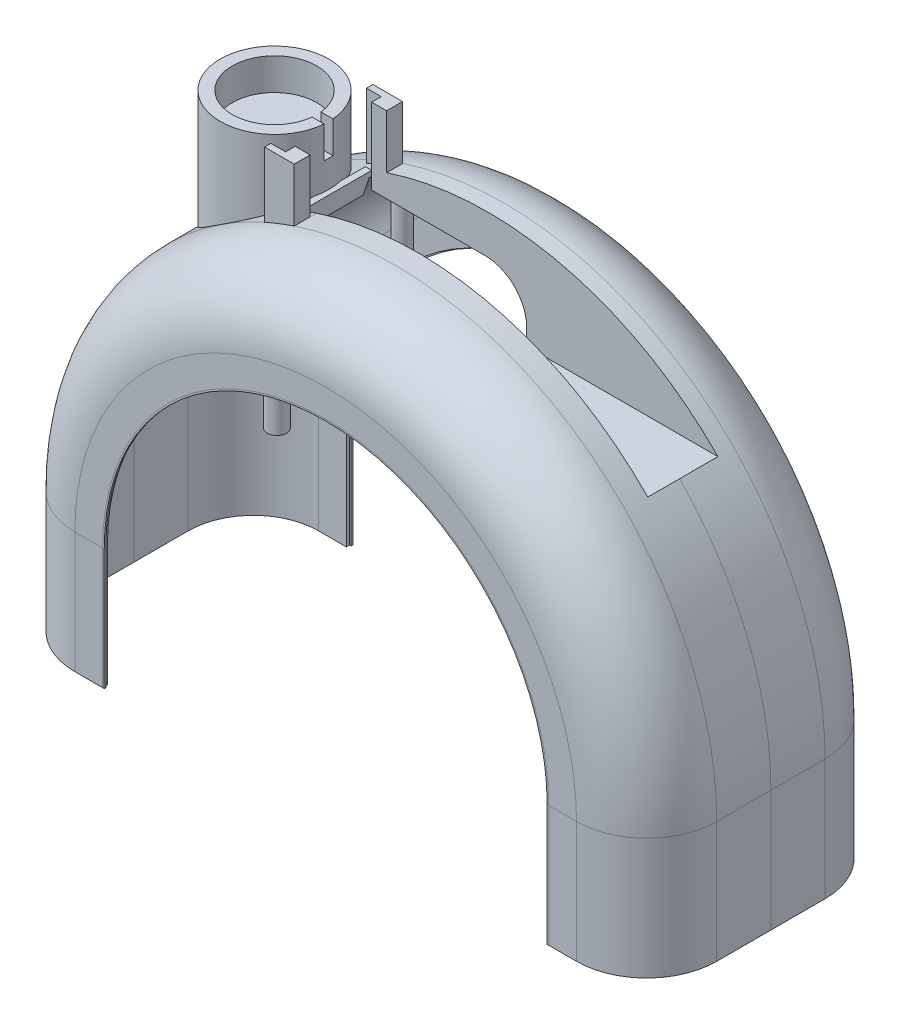
from build123d import *

# Parameters (mm, degrees)
BOSS_EXTRUDE7_REACH       = 234.87
SKETCH4_R                 = 3
SKETCH7_R                 = 3
CUT_EXTRUDE2_DEPTH        = 35.9
SKETCH10_W                = 108.621815142
SKETCH10_H                = 24
CUT_EXTRUDE4_DEPTH        = 217.167286261
SKETCH11_R                = 17
BOSS_EXTRUDE8_DEPTH       = 42
CUT_EXTRUDE5_REACH        = 218.167
CUT_EXTRUDE5_END_RADIUS   = 99.2
BOSS_EXTRUDE11_REACH      = 241.985
BOSS_EXTRUDE11_END_RADIUS = 100.7
CUT_EXTRUDE6_START        = -10
CUT_EXTRUDE6_DEPTH        = 10
SKETCH15_W                = 60
SKETCH15_H                = 24
BOSS_EXTRUDE12_DEPTH      = 2
BOSS_EXTRUDE13_DEPTH      = 2
BOSS_EXTRUDE26_DEPTH      = 2
BOSS_EXTRUDE28_DEPTH      = 2
BOSS_EXTRUDE29_REACH      = 241.985
SKETCH22_R                = 2.5
SKETCH24_R                = 2.5
CUT_EXTRUDE8_DEPTH        = 98.5
SKETCH25_R                = 2.5
CUT_EXTRUDE9_DEPTH        = 108
SKETCH46_R                = 1.25
CUT_EXTRUDE10_DEPTH       = 10
SKETCH47_R                = 1.25
CUT_EXTRUDE11_DEPTH       = 10
SKETCH48_R                = 1.25
CUT_EXTRUDE12_DEPTH       = 10
BOSS_EXTRUDE30_START      = 5.8
SKETCH49_R                = 3
SKETCH49_R_2              = 1.25
BOSS_EXTRUDE30_DEPTH      = 5.8


with BuildPart() as part:
    # Sweep1: sweep along a path in Sketch3
    with BuildLine(Plane.XY) as sweep1_path:
        Line((0, 0), (0, 38))
        ThreePointArc((0, 38), (70, 108), (140, 38))
        Line((140, 38), (140, 0))
    # Sketch1 → Sweep1 (sweep)
    with BuildSketch(Plane(origin=(0, 0, 0), x_dir=(1, 0, 0), z_dir=(0, 1, 0))):
        with BuildLine():
            Line((0, 0), (0, -1))
            Line((0, -1), (0.5, -1))
            Line((0.5, -1), (0.5, -1.5))
            Line((0.5, -1.5), (0, -1.5))
            Line((0, -1.5), (-8.7, -1.5))
            ThreePointArc((-8.7, -1.5), (-24.256349186, 4.943650814), (-30.7, 20.5))
            Line((-30.7, 20.5), (-30.7, 37.5))
            Line((-30.7, 37.5), (-30.7, 54.5))
            ThreePointArc((-30.7, 54.5), (-24.256349186, 70.056349186), (-8.7, 76.5))
            Line((-8.7, 76.5), (0, 76.5))
            Line((0, 76.5), (0.5, 76.5))
            Line((0.5, 76.5), (0.5, 76))
            Line((0.5, 76), (0, 76))
            Line((0, 76), (0, 75))
            Line((0, 75), (-8.7, 75))
            ThreePointArc((-8.7, 75), (-23.195689014, 68.995689014), (-29.2, 54.5))
            Line((-29.2, 54.5), (-29.2, 37.5))
            Line((-29.2, 37.5), (-29.2, 20.5))
            ThreePointArc((-29.2, 20.5), (-23.195689014, 6.004310986), (-8.7, 0))
            Line((-8.7, 0), (0, 0))
        make_face()
    sweep(path=sweep1_path.line)

    # Sketch4 → Boss-Extrude7 (add, up to next)
    with BuildSketch(Plane(origin=(0, 0, 0), x_dir=(1, 0, 0), z_dir=(0, 1, 0)), mode=Mode.PRIVATE) as boss_extrude7_sk1:
        with Locations((-13.2, 8.6)):
            Circle(SKETCH4_R)
    boss_extrude7_tool1 = extrude(boss_extrude7_sk1.sketch, amount=BOSS_EXTRUDE7_REACH, mode=Mode.PRIVATE) - part.part
    # Sketch4 → Boss-Extrude7 (add, up to next)
    with BuildSketch(Plane(origin=(0, 0, 0), x_dir=(1, 0, 0), z_dir=(0, 1, 0)), mode=Mode.PRIVATE) as boss_extrude7_sk2:
        with Locations((153.2, 8.6)):
            Circle(SKETCH4_R)
    boss_extrude7_tool2 = extrude(boss_extrude7_sk2.sketch, amount=BOSS_EXTRUDE7_REACH, mode=Mode.PRIVATE) - part.part
    boss_extrude7_1 = boss_extrude7_tool1.solids().sort_by_distance((-13.2, 0, -8.6))[0]
    add(boss_extrude7_1)
    boss_extrude7_2 = boss_extrude7_tool2.solids().sort_by_distance((153.2, 0, -8.6))[0]
    add(boss_extrude7_2)
    boss_extrude7 = boss_extrude7_1 + boss_extrude7_2  # Boss-Extrude7 as one shape, for the pattern or mirror that repeats it

    # Mirror1: Boss-Extrude7 across plane
    add(boss_extrude7.mirror(Plane.XY.offset(-37.5)))

    # Sketch7 → Cut-Extrude2 (cut)
    with BuildSketch(Plane(origin=(0, 0, 0), x_dir=(1, 0, 0), z_dir=(0, 1, 0))):
        with Locations((-13.2, 8.6)):
            Circle(SKETCH7_R)
        with Locations((-13.2, 66.4)):
            Circle(SKETCH7_R)
        with Locations((153.2, 8.6)):
            Circle(SKETCH7_R)
        with Locations((153.2, 66.4)):
            Circle(SKETCH7_R)
    extrude(amount=CUT_EXTRUDE2_DEPTH, mode=Mode.SUBTRACT)

    # Sketch10 → Cut-Extrude4 (cut, through all)
    with BuildSketch(Plane(origin=(0, 108.34, 0), x_dir=(-1, 0, 0), z_dir=(0, -1, 0))):
        with Locations((-87.75, 37.5)):
            Rectangle(SKETCH10_W, SKETCH10_H)
    extrude(amount=-CUT_EXTRUDE4_DEPTH, mode=Mode.SUBTRACT)

    # Sketch11 → Boss-Extrude8 (add)
    with BuildSketch(Plane(origin=(0, 108.34, 0), x_dir=(-1, 0, 0), z_dir=(0, -1, 0))):
        with Locations((-14.939092429, 37.5)):
            Circle(SKETCH11_R)
    extrude(amount=-BOSS_EXTRUDE8_DEPTH)

    # Cut-Extrude5: up to this cylinder (the profile starts inside it)
    cut_extrude5_end = Plane(origin=(70, 38, -37.5), z_dir=(0, 0, -1)) * Cylinder(CUT_EXTRUDE5_END_RADIUS, 635.734, mode=Mode.PRIVATE)
    # Sketch12 → Cut-Extrude5 (cut, up to the surface)
    with BuildSketch(Plane.XZ.offset(-108.34), mode=Mode.PRIVATE) as cut_extrude5_sk1:
        with BuildLine():
            Line((0.050558258, -29.294419566), (0.050558258, -45.705580434))
            ThreePointArc((0.050558258, -45.705580434), (31.939092429, -37.5), (0.050558258, -29.294419566))
        make_face()
    cut_extrude5_tool1 = extrude(cut_extrude5_sk1.sketch, amount=-CUT_EXTRUDE5_REACH, mode=Mode.PRIVATE) & cut_extrude5_end
    add(cut_extrude5_tool1.solids().sort_by_distance((15.355512, 108.34, -37.5))[0], mode=Mode.SUBTRACT)

    # Boss-Extrude11: up to this cylinder (the profile starts outside it)
    boss_extrude11_end = Plane(origin=(70, 38, -37.5), z_dir=(0, 0, -1)) * Cylinder(BOSS_EXTRUDE11_END_RADIUS, 716.222396, mode=Mode.PRIVATE)
    # Sketch13 → Boss-Extrude11 (add, up to the surface)
    with BuildSketch(Plane(origin=(0, 150.34, 0), x_dir=(1, 0, 0), z_dir=(0, 1, 0)), mode=Mode.PRIVATE) as boss_extrude11_sk1:
        Polygon((28.810209538, 54.5), (38.10406279, 54.5), (38.10406279, 49.5), (33.439092429, 49.5), (33.439092429, 52.5), (28.810209538, 52.5), align=None)
    boss_extrude11_tool1 = extrude(boss_extrude11_sk1.sketch, amount=-BOSS_EXTRUDE11_REACH, mode=Mode.PRIVATE) - boss_extrude11_end
    add(boss_extrude11_tool1.solids().sort_by_distance((34.451237, 150.34, -52.426198))[0])
    # Sketch13 → Boss-Extrude11 (add, up to the surface)
    with BuildSketch(Plane(origin=(0, 150.34, 0), x_dir=(1, 0, 0), z_dir=(0, 1, 0)), mode=Mode.PRIVATE) as boss_extrude11_sk2:
        Polygon((33.439092429, 22.5), (28.810209538, 22.5), (28.810209538, 20.5), (38.10406279, 20.5), (38.10406279, 25.5), (33.439092429, 25.5), align=None)
    boss_extrude11_tool2 = extrude(boss_extrude11_sk2.sketch, amount=-BOSS_EXTRUDE11_REACH, mode=Mode.PRIVATE) - boss_extrude11_end
    add(boss_extrude11_tool2.solids().sort_by_distance((34.451237, 150.34, -22.573802))[0])

    # Sketch14 → Cut-Extrude6 (cut)
    with BuildSketch(Plane(origin=(0, 150.34, 0), x_dir=(1, 0, 0), z_dir=(0, 1, 0)).offset(CUT_EXTRUDE6_START)):
        with BuildLine():
            Line((28.116507767, 38.885), (31.882580116, 38.885))
            ThreePointArc((31.882580116, 38.885), (31.939092429, 37.5), (31.882580116, 36.115))
            Line((31.882580116, 36.115), (28.116507767, 36.115))
            ThreePointArc((28.116507767, 36.115), (1.689092429, 37.5), (28.116507767, 38.885))
        make_face()
    extrude(amount=CUT_EXTRUDE6_DEPTH, mode=Mode.SUBTRACT)

    # Sketch15 → Boss-Extrude12 (add)
    with BuildSketch(Plane(origin=(0, 108.34, 0), x_dir=(-1, 0, 0), z_dir=(0, -1, 0))):
        with Locations((-112.060907571, 37.5)):
            Rectangle(SKETCH15_W, SKETCH15_H)
    extrude(amount=BOSS_EXTRUDE12_DEPTH)

    # Sketch17 → Boss-Extrude13 (add)
    with BuildSketch(Plane(origin=(33.439092429, 0, 0), x_dir=(0, 0, -1), z_dir=(1, 0, 0))):
        Polygon((25.5, 131.82851399), (25.5, 126.42851399), (46.832257308, 126.42851399), (49.5, 131.82851399), align=None)
    extrude(amount=-BOSS_EXTRUDE13_DEPTH)

    # Sketch18 → Boss-Extrude26 (add)
    with BuildSketch(Plane.XY.offset(-49.5)):
        with BuildLine():
            Line((142.060907571, 108.34), (141.904689694, 106.34))
            Line((141.904689694, 106.34), (82.060907571, 106.34))
            Line((82.060907571, 106.34), (82.060907571, 113.42851399))
            ThreePointArc((82.060907571, 113.42851399), (78.253295727, 122.620902145), (69.060907571, 126.42851399))
            Line((69.060907571, 126.42851399), (33.439092429, 126.42851399))
            Line((33.439092429, 126.42851399), (33.439092429, 130.216809951))
            Line((33.439092429, 130.216809951), (33.439092429, 131.82851399))
            Line((33.439092429, 131.82851399), (38.10406279, 133.515125449))
            ThreePointArc((38.10406279, 133.515125449), (93.701327945, 135.871022543), (142.060907571, 108.34))
        make_face()
    extrude(amount=-BOSS_EXTRUDE26_DEPTH)

    # Sketch20 → Boss-Extrude28 (add)
    with BuildSketch(Plane(origin=(0, 0, -25.5), x_dir=(-1, 0, 0), z_dir=(0, 0, -1))):
        with BuildLine():
            Line((-141.904689694, 106.34), (-82.060907571, 106.34))
            Line((-82.060907571, 106.34), (-82.060907571, 113.42851399))
            ThreePointArc((-82.060907571, 113.42851399), (-78.253295727, 122.620902145), (-69.060907571, 126.42851399))
            Line((-69.060907571, 126.42851399), (-33.439092429, 126.42851399))
            Line((-33.439092429, 126.42851399), (-33.439092429, 130.216809951))
            Line((-33.439092429, 130.216809951), (-33.439092429, 131.82851399))
            Line((-33.439092429, 131.82851399), (-38.10406279, 133.515125449))
            ThreePointArc((-38.10406279, 133.515125449), (-93.701327945, 135.871022543), (-142.060907571, 108.34))
            Line((-142.060907571, 108.34), (-141.904689694, 106.34))
        make_face()
    extrude(amount=BOSS_EXTRUDE28_DEPTH)

    # Sketch22 → Boss-Extrude29 (add, up to next)
    with BuildSketch(Plane.XZ, mode=Mode.PRIVATE) as boss_extrude29_sk1:
        with Locations((30.25, -62.3)):
            Circle(SKETCH22_R)
    boss_extrude29_tool1 = extrude(boss_extrude29_sk1.sketch, amount=-BOSS_EXTRUDE29_REACH, mode=Mode.PRIVATE) - part.part
    # Sketch22 → Boss-Extrude29 (add, up to next)
    with BuildSketch(Plane.XZ, mode=Mode.PRIVATE) as boss_extrude29_sk2:
        with Locations((30.25, -16.7)):
            Circle(SKETCH22_R)
    boss_extrude29_tool2 = extrude(boss_extrude29_sk2.sketch, amount=-BOSS_EXTRUDE29_REACH, mode=Mode.PRIVATE) - part.part
    # Sketch22 → Boss-Extrude29 (add, up to next)
    with BuildSketch(Plane.XZ, mode=Mode.PRIVATE) as boss_extrude29_sk3:
        with Locations((86.32, -16.7)):
            Circle(SKETCH22_R)
    boss_extrude29_tool3 = extrude(boss_extrude29_sk3.sketch, amount=-BOSS_EXTRUDE29_REACH, mode=Mode.PRIVATE) - part.part
    # Sketch22 → Boss-Extrude29 (add, up to next)
    with BuildSketch(Plane.XZ, mode=Mode.PRIVATE) as boss_extrude29_sk4:
        with Locations((86.32, -66.3)):
            Circle(SKETCH22_R)
    boss_extrude29_tool4 = extrude(boss_extrude29_sk4.sketch, amount=-BOSS_EXTRUDE29_REACH, mode=Mode.PRIVATE) - part.part
    add(boss_extrude29_tool1.solids().sort_by_distance((30.25, 0, -62.3))[0])
    add(boss_extrude29_tool2.solids().sort_by_distance((30.25, 0, -16.7))[0])
    add(boss_extrude29_tool3.solids().sort_by_distance((86.32, 0, -16.7))[0])
    add(boss_extrude29_tool4.solids().sort_by_distance((86.32, 0, -66.3))[0])

    # Sketch24 → Cut-Extrude8 (cut)
    with BuildSketch(Plane.XZ):
        with Locations((30.25, -16.7)):
            Circle(SKETCH24_R)
        with Locations((30.25, -62.3)):
            Circle(SKETCH24_R)
    extrude(amount=-CUT_EXTRUDE8_DEPTH, mode=Mode.SUBTRACT)

    # Sketch25 → Cut-Extrude9 (cut)
    with BuildSketch(Plane.XZ):
        with Locations((86.32, -16.7)):
            Circle(SKETCH25_R)
        with Locations((86.32, -66.3)):
            Circle(SKETCH25_R)
    extrude(amount=-CUT_EXTRUDE9_DEPTH, mode=Mode.SUBTRACT)

    # Sketch46 → Cut-Extrude10 (cut)
    with BuildSketch(Plane.XZ.offset(-35.9)):
        with Locations((-13.2, -66.4)):
            Circle(SKETCH46_R)
        with Locations((-13.2, -8.6)):
            Circle(SKETCH46_R)
        with Locations((153.2, -8.6)):
            Circle(SKETCH46_R)
        with Locations((153.2, -66.4)):
            Circle(SKETCH46_R)
    extrude(amount=-CUT_EXTRUDE10_DEPTH, mode=Mode.SUBTRACT)

    # Sketch47 → Cut-Extrude11 (cut)
    with BuildSketch(Plane.XZ.offset(-108)):
        with Locations((86.32, -66.3)):
            Circle(SKETCH47_R)
        with Locations((86.32, -16.7)):
            Circle(SKETCH47_R)
    extrude(amount=-CUT_EXTRUDE11_DEPTH, mode=Mode.SUBTRACT)

    # Sketch48 → Cut-Extrude12 (cut)
    with BuildSketch(Plane.XZ.offset(-98.5)):
        with Locations((30.25, -16.7)):
            Circle(SKETCH48_R)
        with Locations((30.25, -62.3)):
            Circle(SKETCH48_R)
    extrude(amount=-CUT_EXTRUDE12_DEPTH, mode=Mode.SUBTRACT)

    # Sketch49 → Boss-Extrude30 (add)
    # profile 1 of 4: a face of its own
    with BuildSketch(Plane.XZ.offset(-35.9).offset(BOSS_EXTRUDE30_START)):
        with Locations((153.2, -66.4)):
            Circle(SKETCH49_R)
        with Locations((153.2, -66.4)):
            Circle(SKETCH49_R_2, mode=Mode.SUBTRACT)
    # profile 2 of 4: a face of its own
    with BuildSketch(Plane.XZ.offset(-35.9).offset(BOSS_EXTRUDE30_START)):
        with Locations((-13.2, -8.6)):
            Circle(SKETCH49_R)
    # profile 3 of 4: a face of its own
    with BuildSketch(Plane.XZ.offset(-35.9).offset(BOSS_EXTRUDE30_START)):
        with Locations((153.2, -8.6)):
            Circle(SKETCH49_R)
        with Locations((153.2, -8.6)):
            Circle(SKETCH49_R_2, mode=Mode.SUBTRACT)
    # profile 4 of 4: a face of its own
    with BuildSketch(Plane.XZ.offset(-35.9).offset(BOSS_EXTRUDE30_START)):
        with Locations((-13.2, -66.4)):
            Circle(SKETCH49_R)
        with Locations((-13.2, -66.4)):
            Circle(SKETCH49_R_2, mode=Mode.SUBTRACT)
    extrude(amount=-BOSS_EXTRUDE30_DEPTH)


solid = part.part
